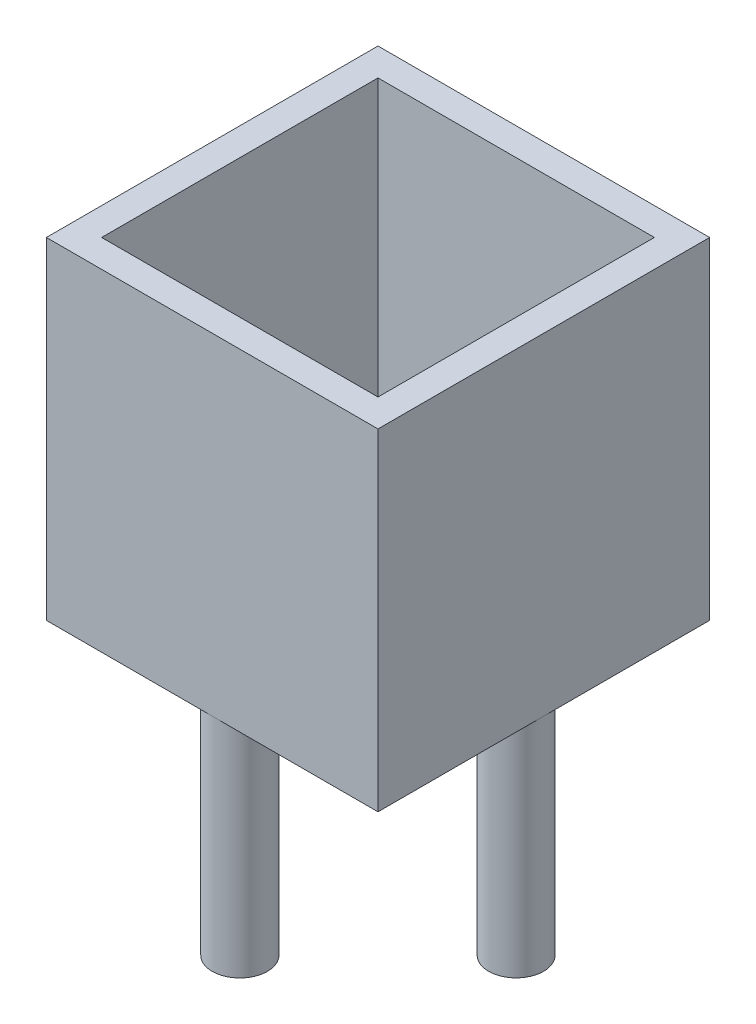
from build123d import *

# Parameters (mm, degrees)
SKETCH2_W             = 120
SKETCH2_H             = 120
SKETCH2_W_2           = 100
SKETCH2_H_2           = 100
BOSS_EXTRUDE1_DEPTH   = 120
SKETCH3_W             = 120
SKETCH3_H             = 120
BOSS_EXTRUDE2_DEPTH   = 10
SKETCH4_W             = 80
SKETCH4_H             = 80
BOSS_EXTRUDE3_DEPTH   = 30
SKETCH5_R             = 25
CUT_EXTRUDE2_DEPTH    = 25
FILLET1_R             = 25
SKETCH7_R             = 10
BOSS_EXTRUDE5_DEPTH   = 80
SKETCH7_R_2           = 9.976410379
BOSS_EXTRUDE5_2_DEPTH = 80
BOSS_EXTRUDE5_3_DEPTH = 80
BOSS_EXTRUDE5_4_DEPTH = 80
SKETCH8_W             = 80
SKETCH8_H             = 80
CUT_EXTRUDE4_DEPTH    = 30


with BuildPart() as part:
    # Sketch2 → Boss-Extrude1 (new body)
    with BuildSketch(Plane(origin=(0, 0, 0), x_dir=(1, 0, 0), z_dir=(0, 1, 0))):
        Rectangle(SKETCH2_W, SKETCH2_H)
        Rectangle(SKETCH2_W_2, SKETCH2_H_2, mode=Mode.SUBTRACT)
    extrude(amount=BOSS_EXTRUDE1_DEPTH)

    # Sketch3 → Boss-Extrude2 (add)
    with BuildSketch(Plane.XZ):
        Rectangle(SKETCH3_W, SKETCH3_H)
    extrude(amount=-BOSS_EXTRUDE2_DEPTH)

    # Sketch4 → Boss-Extrude3 (add)
    with BuildSketch(Plane.XZ):
        Rectangle(SKETCH4_W, SKETCH4_H)
    extrude(amount=BOSS_EXTRUDE3_DEPTH)

    # Sketch5 → Cut-Extrude2 (cut)
    with BuildSketch(Plane(origin=(0, -30, 0), x_dir=(-1, 0, 0), z_dir=(0, -1, 0))):
        with Locations(Location((0, 0, 0), (0, 0, 90))):
            Circle(SKETCH5_R)
    extrude(amount=-CUT_EXTRUDE2_DEPTH, mode=Mode.SUBTRACT)

    # Fillet1
    fillet1_edges = [part.edges().sort_by_distance(p)[0] for p in [
        (0, -5, 25),
    ]]
    fillet(fillet1_edges, radius=FILLET1_R - 0.0001)  # a hair under: the kernel refuses the full size

    # Sketch8 → Cut-Extrude4 (cut)
    with BuildSketch(Plane.XZ.offset(30)):
        Rectangle(SKETCH8_W, SKETCH8_H)
    extrude(amount=-CUT_EXTRUDE4_DEPTH, mode=Mode.SUBTRACT)


with BuildPart() as body_2:
    # Sketch7 → Boss-Extrude5 (new body)
    with BuildSketch(Plane.XZ):
        with Locations(Location((0, -50, 0), (0, 0, 270))):
            Circle(SKETCH7_R)
    extrude(amount=BOSS_EXTRUDE5_DEPTH)


with BuildPart() as body_3:
    # Sketch7 → Boss-Extrude5 2 (new body)
    with BuildSketch(Plane.XZ):
        with Locations(Location((49.976410379, 0, 0), (0, 0, 270))):
            Circle(SKETCH7_R_2)
    extrude(amount=BOSS_EXTRUDE5_2_DEPTH)


with BuildPart() as body_4:
    # Sketch7 → Boss-Extrude5 3 (new body)
    with BuildSketch(Plane.XZ):
        with Locations(Location((0, 50, 0), (0, 0, 270))):
            Circle(SKETCH7_R)
    extrude(amount=BOSS_EXTRUDE5_3_DEPTH)


with BuildPart() as body_5:
    # Sketch7 → Boss-Extrude5 4 (new body)
    with BuildSketch(Plane.XZ):
        with Locations(Location((-50, 0, 0), (0, 0, 270))):
            Circle(SKETCH7_R)
    extrude(amount=BOSS_EXTRUDE5_4_DEPTH)


solid = Compound([part.part, body_2.part, body_3.part, body_4.part, body_5.part])
